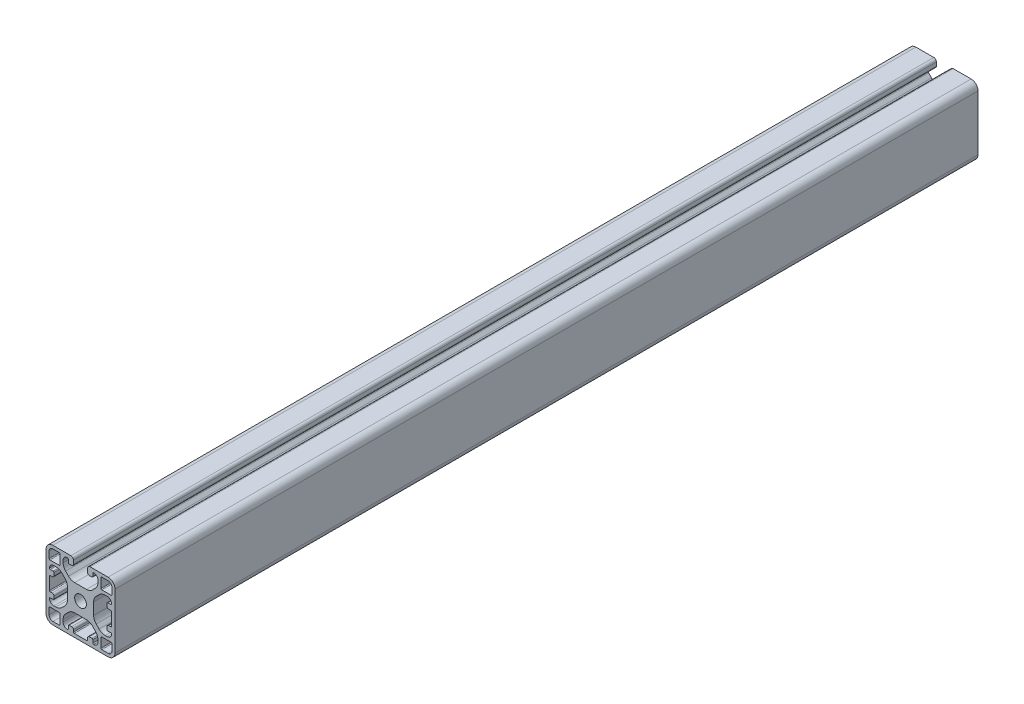
from build123d import *

# Parameters (mm, degrees)
SKIZZE1_R                       = 3.4
AUFSATZ_LINEAR_AUSTRAGEN1_DEPTH = 500
M3_GEWINDEBOHRUNG1_OUTLINE_W    = 1.25
M3_GEWINDEBOHRUNG1_OUTLINE_H    = 4.43814913
M3_GEWINDEBOHRUNG1_OUTLINE_H_2  = 2.000000006
LINEARES_MUSTER1_COUNT          = 9
LINEARES_MUSTER1_PITCH          = 25
LINEARES_MUSTER1_COL_COUNT      = 9
LINEARES_MUSTER1_COL_PITCH      = 25


# Read off the part's stored shape, not the designer's step: M3 Gewindebohrung1
with BuildPart() as part:
    # Skizze1 → Aufsatz-Linear austragen1 (new body)
    with BuildSketch(Plane.XY.offset(1000)):
        with BuildLine():
            Line((23.100000014, 35.850000004), (23.100000014, 37.500000007))
            ThreePointArc((23.100000014, 37.500000007), (23.246446625, 37.8535534), (23.600000018, 38.000000007))
            ThreePointArc((23.600000018, 38.000000007), (25.367766957, 37.267766953), (26.099999996, 35.500000007))
            Line((26.099999996, 35.500000007), (26.099999996, 34.292388137))
            ThreePointArc((26.099999996, 34.292388137), (25.719397659, 32.378970975), (24.635533902, 30.756854231))
            Line((24.635533902, 30.756854231), (22.943145774, 29.064466103))
            ThreePointArc((22.943145774, 29.064466103), (21.32102903, 27.980602346), (19.407611868, 27.600000008))
            Line((19.407611868, 27.600000008), (12.592388142, 27.600000008))
            ThreePointArc((12.592388142, 27.600000008), (10.678970981, 27.980602346), (9.056854237, 29.064466102))
            Line((9.056854237, 29.064466102), (7.36446608, 30.75685426))
            ThreePointArc((7.36446608, 30.75685426), (6.280602323, 32.378971004), (5.899999986, 34.292388165))
            Line((5.899999986, 34.292388165), (5.899999986, 35.500000003))
            ThreePointArc((5.899999986, 35.500000003), (6.632233037, 37.267766961), (8.399999999, 38.000000003))
            ThreePointArc((8.399999999, 38.000000003), (8.753553388, 37.853553393), (8.899999996, 37.500000003))
            Line((8.899999996, 37.500000003), (8.899999996, 35.850000004))
            ThreePointArc((8.899999996, 35.850000004), (9.046446605, 35.496446613), (9.399999996, 35.350000004))
            Line((9.399999996, 35.350000004), (10.899999944, 35.350000004))
            ThreePointArc((10.899999944, 35.350000004), (11.607106725, 35.642893223), (11.899999944, 36.350000004))
            Line((11.899999944, 36.350000004), (11.899999944, 38.500000016))
            ThreePointArc((11.899999944, 38.500000016), (11.460660115, 39.560660188), (10.399999943, 40.000000016))
            Line((10.399999943, 40.000000016), (4.8e-08, 40.000000016))
            ThreePointArc((4.8e-08, 40.000000016), (-2.828427121, 38.828427123), (-4.000000014, 35.999999954))
            Line((-4.000000014, 35.999999954), (-4.000000014, 4.000000069))
            ThreePointArc((-4.000000014, 4.000000069), (-2.828427124, 1.171572908), (3.7e-08, 1.8e-08))
            Line((3.7e-08, 1.8e-08), (31.999999922, 1.8e-08))
            ThreePointArc((31.999999922, 1.8e-08), (34.828427083, 1.171572908), (35.999999974, 4.000000069))
            Line((35.999999974, 4.000000069), (35.999999974, 35.999999953))
            ThreePointArc((35.999999974, 35.999999953), (34.82842708, 38.828427122), (31.99999991, 40.000000016))
            Line((31.99999991, 40.000000016), (21.599999961, 40.000000016))
            ThreePointArc((21.599999961, 40.000000016), (20.53933979, 39.560660188), (20.099999962, 38.500000017))
            Line((20.099999962, 38.500000017), (20.099999962, 36.350000004))
            ThreePointArc((20.099999962, 36.350000004), (20.392893181, 35.642893223), (21.099999962, 35.350000004))
            Line((21.099999962, 35.350000004), (22.600000014, 35.350000004))
            ThreePointArc((22.600000014, 35.350000004), (22.953553405, 35.496446613), (23.100000014, 35.850000004))
        make_face()
        with Locations(Location((15.999999985, 20, 0), (0, 0, 180))):
            Circle(SKIZZE1_R, mode=Mode.SUBTRACT)
        with BuildLine():
            Line((4.8e-08, 38.200000033), (3.699999945, 38.200000033))
            ThreePointArc((3.699999945, 38.200000033), (4.053553343, 38.053553421), (4.199999956, 37.700000022))
            Line((4.199999956, 37.700000022), (4.199999956, 32.299999708))
            ThreePointArc((4.199999956, 32.299999708), (4.053553442, 31.946446549), (3.700000282, 31.800000035))
            Line((3.700000282, 31.800000035), (-1.70000008, 31.800000035))
            ThreePointArc((-1.70000008, 31.800000035), (-2.053553436, 31.94644663), (-2.200000031, 32.299999986))
            Line((-2.200000031, 32.299999986), (-2.200000031, 35.999999954))
            ThreePointArc((-2.200000031, 35.999999954), (-1.555634927, 37.555634929), (4.8e-08, 38.200000033))
        make_face(mode=Mode.SUBTRACT)
        with BuildLine():
            Line((-2.200000031, 4.000000069), (-2.200000031, 7.699999986))
            ThreePointArc((-2.200000031, 7.699999986), (-2.053553419, 8.053553385), (-1.70000002, 8.199999998))
            Line((-1.70000002, 8.199999998), (3.700000282, 8.199999998))
            ThreePointArc((3.700000282, 8.199999998), (4.053553442, 8.053553484), (4.199999956, 7.700000324))
            Line((4.199999956, 7.700000324), (4.199999956, 2.299999952))
            ThreePointArc((4.199999956, 2.299999952), (4.053553361, 1.946446596), (3.700000004, 1.800000001))
            Line((3.700000004, 1.800000001), (3.7e-08, 1.800000001))
            ThreePointArc((3.7e-08, 1.800000001), (-1.55563493, 2.444365102), (-2.200000031, 4.000000069))
        make_face(mode=Mode.SUBTRACT)
        with BuildLine():
            Line((31.999999922, 1.800000001), (28.300000004, 1.800000001))
            ThreePointArc((28.300000004, 1.800000001), (27.946446606, 1.946446613), (27.799999993, 2.300000012))
            Line((27.799999993, 2.300000012), (27.799999993, 7.700000324))
            ThreePointArc((27.799999993, 7.700000324), (27.946446507, 8.053553484), (28.299999667, 8.199999998))
            Line((28.299999667, 8.199999998), (33.700000039, 8.199999998))
            ThreePointArc((33.700000039, 8.199999998), (34.053553395, 8.053553402), (34.199999991, 7.700000046))
            Line((34.199999991, 7.700000046), (34.199999991, 4.000000069))
            ThreePointArc((34.199999991, 4.000000069), (33.555634889, 2.444365102), (31.999999922, 1.800000001))
        make_face(mode=Mode.SUBTRACT)
        with BuildLine():
            Line((34.199999991, 35.999999953), (34.199999991, 32.300000046))
            ThreePointArc((34.199999991, 32.300000046), (34.053553378, 31.946446648), (33.699999979, 31.800000035))
            Line((33.699999979, 31.800000035), (28.299999667, 31.800000035))
            ThreePointArc((28.299999667, 31.800000035), (27.946446507, 31.946446549), (27.799999993, 32.299999708))
            Line((27.799999993, 32.299999708), (27.799999993, 37.700000082))
            ThreePointArc((27.799999993, 37.700000082), (27.946446588, 38.053553438), (28.299999945, 38.200000033))
            Line((28.299999945, 38.200000033), (31.99999991, 38.200000033))
            ThreePointArc((31.99999991, 38.200000033), (33.555634886, 37.555634928), (34.199999991, 35.999999953))
        make_face(mode=Mode.SUBTRACT)
        with BuildLine():
            Line((12.592388143, 12.399999997), (19.407611847, 12.399999997))
            ThreePointArc((19.407611847, 12.399999997), (21.321029009, 12.01939766), (22.943145752, 10.935533904))
            Line((22.943145752, 10.935533904), (24.635533902, 9.243145754))
            ThreePointArc((24.635533902, 9.243145754), (25.719397659, 7.62102901), (26.099999996, 5.707611848))
            Line((26.099999996, 5.707611848), (26.099999996, 4.499999993))
            ThreePointArc((26.099999996, 4.499999993), (25.367766957, 2.732233048), (23.600000018, 1.999999995))
            ThreePointArc((23.600000018, 1.999999995), (23.246446625, 2.146446603), (23.100000014, 2.499999995))
            Line((23.100000014, 2.499999995), (23.100000014, 4.149999994))
            ThreePointArc((23.100000014, 4.149999994), (22.953553405, 4.503553383), (22.600000016, 4.649999992))
            Line((22.600000016, 4.649999992), (21.099999962, 4.649999992))
            ThreePointArc((21.099999962, 4.649999992), (20.392893181, 4.357106773), (20.099999962, 3.649999992))
            Line((20.099999962, 3.649999992), (20.099999962, 2.500000006))
            ThreePointArc((20.099999962, 2.500000006), (19.953553353, 2.146446616), (19.599999962, 2.000000006))
            Line((19.599999962, 2.000000006), (12.399999942, 2.000000006))
            ThreePointArc((12.399999942, 2.000000006), (12.046446553, 2.146446615), (11.899999944, 2.500000005))
            Line((11.899999944, 2.500000005), (11.899999944, 3.649999992))
            ThreePointArc((11.899999944, 3.649999992), (11.607106725, 4.357106773), (10.899999943, 4.649999992))
            Line((10.899999943, 4.649999992), (9.399999996, 4.649999992))
            ThreePointArc((9.399999996, 4.649999992), (9.046446606, 4.503553382), (8.899999996, 4.149999992))
            Line((8.899999996, 4.149999992), (8.899999996, 2.499999991))
            ThreePointArc((8.899999996, 2.499999991), (8.753553389, 2.146446604), (8.400000003, 1.999999994))
            ThreePointArc((8.400000003, 1.999999994), (6.632233039, 2.732233035), (5.899999986, 4.499999994))
            Line((5.899999986, 4.499999994), (5.899999986, 5.707611838))
            ThreePointArc((5.899999986, 5.707611838), (6.280602323, 7.621029001), (7.36446608, 9.243145746))
            Line((7.36446608, 9.243145746), (9.056854238, 10.935533903))
            ThreePointArc((9.056854238, 10.935533903), (10.678970982, 12.01939766), (12.592388143, 12.399999997))
        make_face(mode=Mode.SUBTRACT)
        with BuildLine():
            Line((-0.350000011, 15.899999977), (-1.500000012, 15.899999977))
            ThreePointArc((-1.500000012, 15.899999977), (-1.853553403, 16.046446586), (-2.000000012, 16.399999977))
            Line((-2.000000012, 16.399999977), (-2.000000012, 23.599999997))
            ThreePointArc((-2.000000012, 23.599999997), (-1.853553403, 23.953553386), (-1.500000014, 24.099999995))
            Line((-1.500000014, 24.099999995), (-0.350000011, 24.099999995))
            ThreePointArc((-0.350000011, 24.099999995), (0.35710677, 24.392893214), (0.649999989, 25.099999995))
            Line((0.649999989, 25.099999995), (0.649999989, 26.599999997))
            ThreePointArc((0.649999989, 26.599999997), (0.503553379, 26.953553388), (0.149999989, 27.099999997))
            Line((0.149999989, 27.099999997), (-1.500000012, 27.099999997))
            ThreePointArc((-1.500000012, 27.099999997), (-1.853553399, 27.246446604), (-2.000000009, 27.599999991))
            ThreePointArc((-2.000000009, 27.599999991), (-1.267766968, 29.367766955), (0.499999991, 30.100000008))
            Line((0.499999991, 30.100000008), (1.707611836, 30.100000008))
            ThreePointArc((1.707611836, 30.100000008), (3.621028998, 29.71939767), (5.243145743, 28.635533913))
            Line((5.243145743, 28.635533913), (6.935533893, 26.943145763))
            ThreePointArc((6.935533893, 26.943145763), (8.01939765, 25.321029019), (8.399999987, 23.407611857))
            Line((8.399999987, 23.407611857), (8.399999987, 16.592388128))
            ThreePointArc((8.399999987, 16.592388128), (8.01939765, 14.678970966), (6.935533894, 13.056854223))
            Line((6.935533894, 13.056854223), (5.243145736, 11.364466065))
            ThreePointArc((5.243145736, 11.364466065), (3.621028992, 10.280602309), (1.70761183, 9.899999971))
            Line((1.70761183, 9.899999971), (0.49999999, 9.899999971))
            ThreePointArc((0.49999999, 9.899999971), (-1.267766966, 10.632233022), (-2.000000008, 12.399999982))
            ThreePointArc((-2.000000008, 12.399999982), (-1.853553397, 12.753553371), (-1.500000008, 12.899999979))
            Line((-1.500000008, 12.899999979), (0.149999991, 12.899999979))
            ThreePointArc((0.149999991, 12.899999979), (0.50355338, 13.046446588), (0.649999989, 13.399999977))
            Line((0.649999989, 13.399999977), (0.649999989, 14.899999976))
            ThreePointArc((0.649999989, 14.899999976), (0.35710677, 15.607106758), (-0.350000011, 15.899999977))
        make_face(mode=Mode.SUBTRACT)
        with BuildLine():
            Line((23.599999999, 16.592388152), (23.599999999, 23.407611854))
            ThreePointArc((23.599999999, 23.407611854), (23.980602337, 25.321029015), (25.064466093, 26.943145759))
            Line((25.064466093, 26.943145759), (26.756854248, 28.635533914))
            ThreePointArc((26.756854248, 28.635533914), (28.378970992, 29.71939767), (30.292388154, 30.100000008))
            Line((30.292388154, 30.100000008), (31.49999999, 30.100000008))
            ThreePointArc((31.49999999, 30.100000008), (33.267766947, 29.367766956), (33.999999988, 27.599999994))
            ThreePointArc((33.999999988, 27.599999994), (33.853553377, 27.246446605), (33.499999988, 27.099999997))
            Line((33.499999988, 27.099999997), (31.849999989, 27.099999997))
            ThreePointArc((31.849999989, 27.099999997), (31.4964466, 26.953553388), (31.349999991, 26.6))
            Line((31.349999991, 26.6), (31.349999991, 25.099999995))
            ThreePointArc((31.349999991, 25.099999995), (31.64289321, 24.392893214), (32.349999991, 24.099999995))
            Line((32.349999991, 24.099999995), (33.499999986, 24.099999995))
            ThreePointArc((33.499999986, 24.099999995), (33.853553377, 23.953553386), (33.999999986, 23.599999995))
            Line((33.999999986, 23.599999995), (33.999999986, 16.399999975))
            ThreePointArc((33.999999986, 16.399999975), (33.853553377, 16.046446586), (33.499999988, 15.899999977))
            Line((33.499999988, 15.899999977), (32.349999991, 15.899999977))
            ThreePointArc((32.349999991, 15.899999977), (31.64289321, 15.607106758), (31.349999991, 14.899999977))
            Line((31.349999991, 14.899999977), (31.349999991, 13.39999998))
            ThreePointArc((31.349999991, 13.39999998), (31.496446601, 13.046446589), (31.849999991, 12.899999979))
            Line((31.849999991, 12.899999979), (33.499999992, 12.899999979))
            ThreePointArc((33.499999992, 12.899999979), (33.85355338, 12.753553372), (33.999999989, 12.399999985))
            ThreePointArc((33.999999989, 12.399999985), (33.267766947, 10.632233023), (31.499999989, 9.899999971))
            Line((31.499999989, 9.899999971), (30.292388181, 9.899999971))
            ThreePointArc((30.292388181, 9.899999971), (28.378971018, 10.280602309), (26.756854273, 11.364466066))
            Line((26.756854273, 11.364466066), (25.064466093, 13.056854246))
            ThreePointArc((25.064466093, 13.056854246), (23.980602337, 14.67897099), (23.599999999, 16.592388152))
        make_face(mode=Mode.SUBTRACT)
    extrude(amount=-AUFSATZ_LINEAR_AUSTRAGEN1_DEPTH)

    # M3 Gewindebohrung1 outline → M3 Gewindebohrung1 (revolve, cut)
    with BuildSketch(Plane(origin=(15.999999979, 0, 750), x_dir=(1, 0, 0), z_dir=(0, 0, 1))):
        with Locations((0.625, 14.619074562)):
            Rectangle(M3_GEWINDEBOHRUNG1_OUTLINE_W, M3_GEWINDEBOHRUNG1_OUTLINE_H)
        Polygon((0, 23.161850877), (1.25, 23.161850877), (1.25, 27.325000008), (1.525, 27.600000008), (0, 27.600000008), align=None)
        with Locations((0.625, 1.000000003)):
            Rectangle(M3_GEWINDEBOHRUNG1_OUTLINE_W, M3_GEWINDEBOHRUNG1_OUTLINE_H_2)
    m3_gewindebohrung1 = revolve(axis=Axis((15.999999979, 0, 750), (0, 1, 0)), mode=Mode.SUBTRACT)

    # Lineares Muster1: M3 Gewindebohrung1 ×9
    with Locations(*[(0, 0, -i * LINEARES_MUSTER1_PITCH) for i in range(1, LINEARES_MUSTER1_COUNT)]):
        add(m3_gewindebohrung1, mode=Mode.SUBTRACT)

    # Lineares Muster1 col: M3 Gewindebohrung1 ×9
    with Locations(*[(0, 0, i * LINEARES_MUSTER1_COL_PITCH) for i in range(1, LINEARES_MUSTER1_COL_COUNT)]):
        add(m3_gewindebohrung1, mode=Mode.SUBTRACT)


solid = part.part
